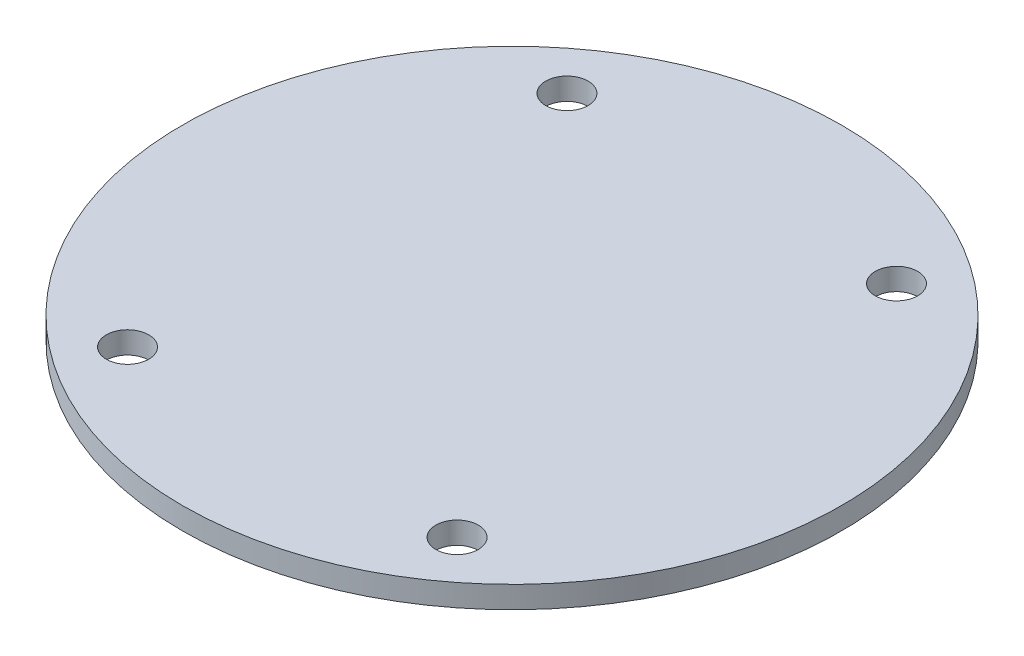
from build123d import *

# Parameters (mm, degrees)
SKETCH2_R                       = 30
ACRYLICBASE_DEPTH               = 2
F_24_0_152_DIAMETER_HOLE1_D     = 3.8608
F_24_0_152_DIAMETER_HOLE1_DEPTH = 25.4
F_24_0_152_DIAMETER_HOLE1_TIP   = 1.159901339


with BuildPart() as part:
    # Sketch2 → AcrylicBase (new body)
    with BuildSketch(Plane(origin=(0, 0, 0), x_dir=(1, 0, 0), z_dir=(0, 1, 0))):
        Circle(SKETCH2_R)
    extrude(amount=-ACRYLICBASE_DEPTH)

    # #24 (0.152) Diameter Hole1
    with Locations(Plane(origin=(0, 0, 0), x_dir=(-1, 0, 0), z_dir=(0, 1, 0))):
        with Locations((15, -20), (-15, -20), (-15, 20), (15, 20)):
            Hole(F_24_0_152_DIAMETER_HOLE1_D / 2, depth=F_24_0_152_DIAMETER_HOLE1_DEPTH)
            with Locations((0, 0, -(F_24_0_152_DIAMETER_HOLE1_DEPTH + F_24_0_152_DIAMETER_HOLE1_TIP / 2))):  # 118° drill point
                Cone(0, F_24_0_152_DIAMETER_HOLE1_D / 2, F_24_0_152_DIAMETER_HOLE1_TIP, mode=Mode.SUBTRACT)


solid = part.part
